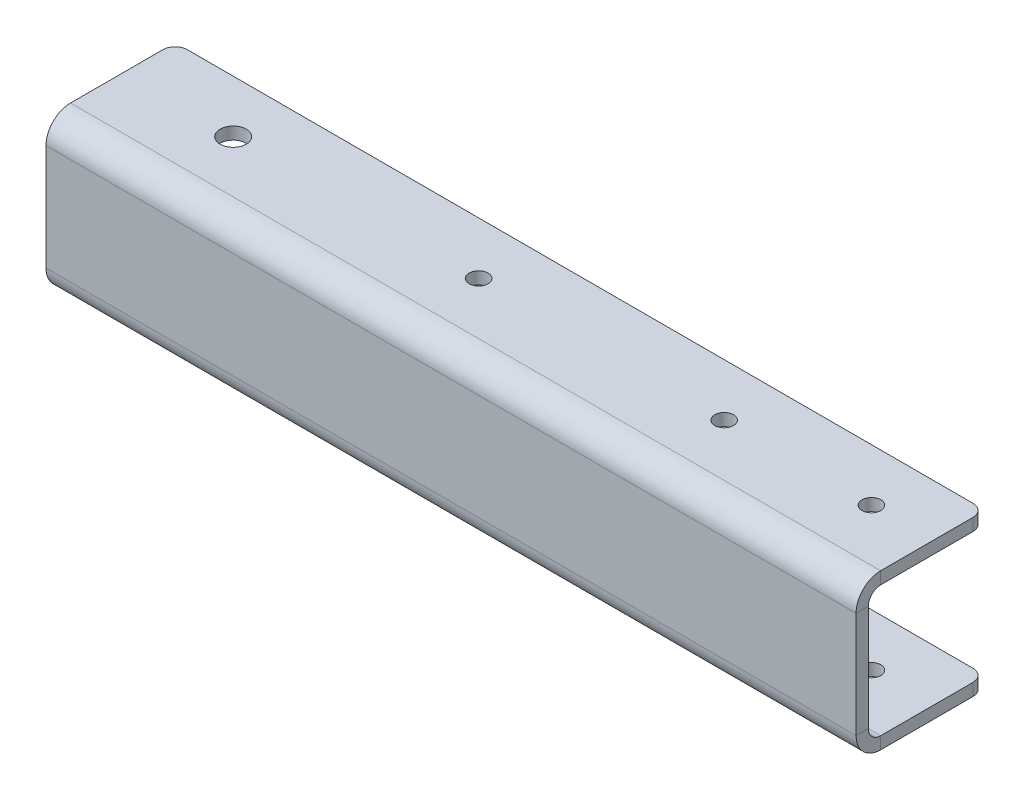
from build123d import *

# Parameters (mm, degrees)
BASE_FLANGE1_DEPTH = 209.55
SKETCH6_R          = 3.3782
SKETCH6_R_2        = 2.4257
CUT_EXTRUDE1_DEPTH = 216.488725923
FILLET1_R          = 3.175


# Sheet-metal steps are written as plain solids
with BuildPart() as part:
    # Sketch1 → Base-Flange1 (new body)
    with BuildSketch(Plane(origin=(0, 0, 0), x_dir=(0, 0, -1), z_dir=(1, 0, 0))):
        with BuildLine():
            Line((30.226, 33.782), (3.175, 33.782))
            ThreePointArc((3.175, 33.782), (0.92993597, 32.85206403), (0, 30.607))
            Line((0, 30.607), (0, 3.175))
            ThreePointArc((0, 3.175), (0.92993597, 0.92993597), (3.175, 0))
            Line((3.175, 0), (30.226, 0))
            Line((30.226, 0), (30.226, -3.175))
            Line((30.226, -3.175), (3.175, -3.175))
            ThreePointArc((3.175, -3.175), (-1.315128061, -1.315128061), (-3.175, 3.175))
            Line((-3.175, 3.175), (-3.175, 30.607))
            ThreePointArc((-3.175, 30.607), (-1.315128061, 35.097128061), (3.175, 36.957))
            Line((3.175, 36.957), (30.226, 36.957))
            Line((30.226, 36.957), (30.226, 33.782))
        make_face()
    extrude(amount=BASE_FLANGE1_DEPTH)

    # Sketch6 → Cut-Extrude1 (cut, through all)
    with BuildSketch(Plane(origin=(0, 36.957, 0), x_dir=(1, 0, 0), z_dir=(0, 1, 0))):
        with Locations(Location((28.575, 16.66875, 0), (0, 0, 270))):
            Circle(SKETCH6_R)
        with Locations(Location((92.075, 16.66875, 0), (0, 0, 270))):
            Circle(SKETCH6_R_2)
        with Locations(Location((155.575, 16.66875, 0), (0, 0, 270))):
            Circle(SKETCH6_R_2)
        with Locations(Location((193.675, 16.66875, 0), (0, 0, 270))):
            Circle(SKETCH6_R_2)
    extrude(amount=-CUT_EXTRUDE1_DEPTH, mode=Mode.SUBTRACT)

    # Fillet1
    fillet1_edges = [part.edges().sort_by_distance(p)[0] for p in [
        (0, -1.5875, -30.226),
        (0, 35.3695, -30.226),
        (209.55, -1.5875, -30.226),
        (209.55, 35.3695, -30.226),
    ]]
    fillet(fillet1_edges, radius=FILLET1_R)


solid = part.part
